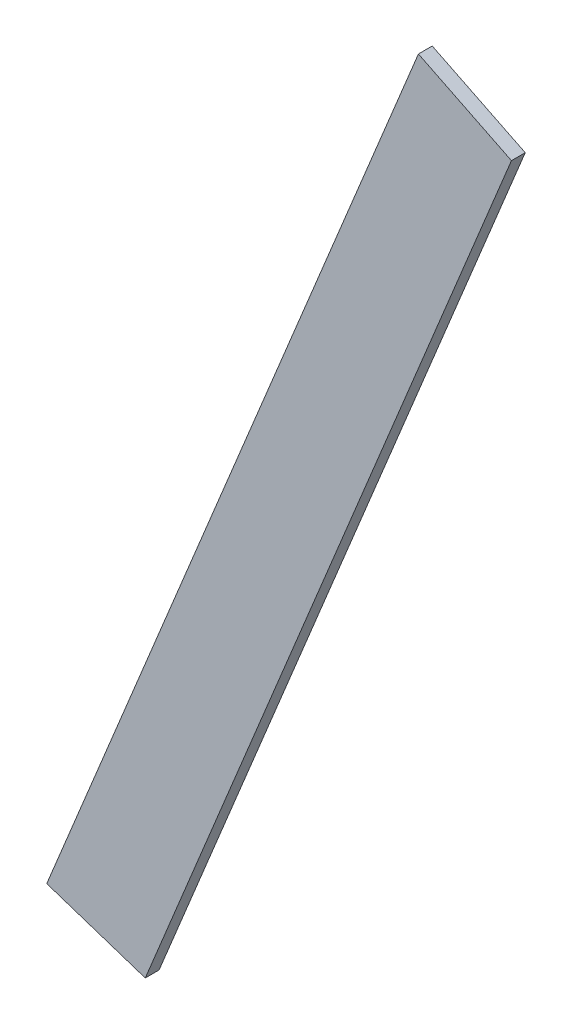
from build123d import *

# Parameters (mm, degrees)
BOSS_EXTRUDE1_DEPTH = 2


with BuildPart() as part:
    # Sketch1 → Boss-Extrude1 (new body)
    with BuildSketch(Plane.XY):
        Polygon((31.679954156, -12.073647161), (17.398719743, -7.362565692), (71.282423113, 123.744103316), (84.766200378, 117.092695854), align=None)
    extrude(amount=BOSS_EXTRUDE1_DEPTH)


solid = part.part
